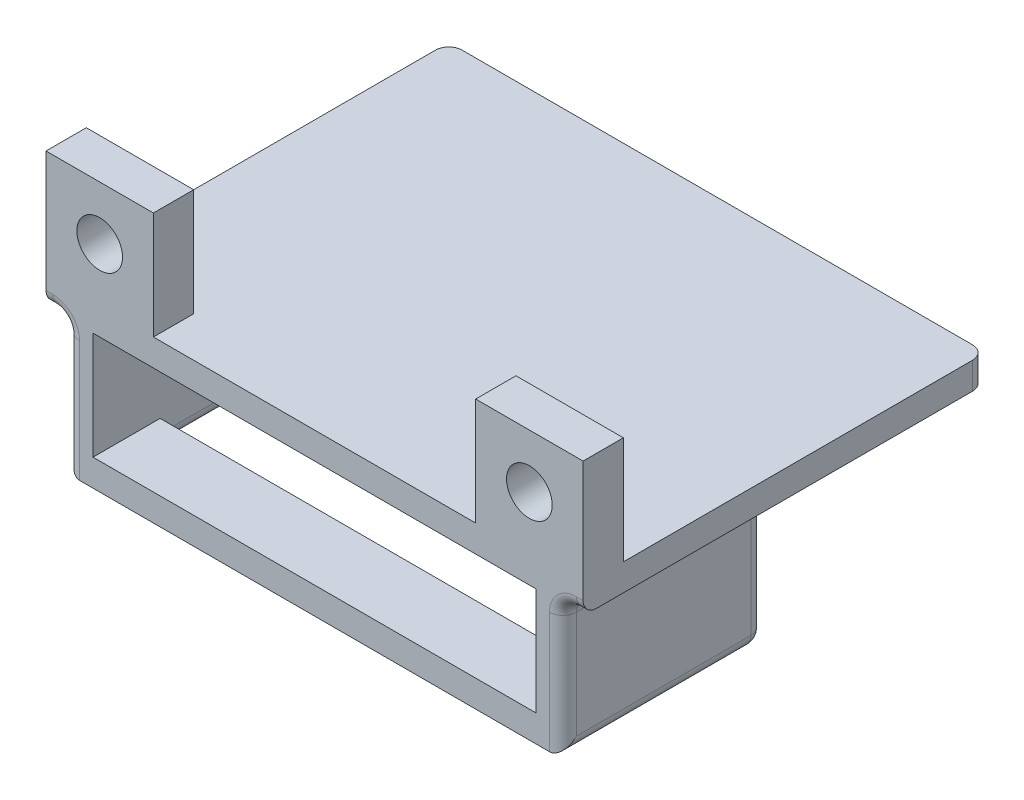
from build123d import *

# Parameters (mm, degrees)
SKETCH1_W            = 40
SKETCH1_H            = 30
BOSS_EXTRUDE1_DEPTH  = 1
SKETCH2_W            = 8
SKETCH2_H            = 3
BOSS_EXTRUDE2_DEPTH  = 8
M3_CLEARANCE_HOLE1_D = 3.4
BOSS_EXTRUDE3_DEPTH  = 5
SKETCH8_W            = 2
SKETCH8_H            = 10
BOSS_EXTRUDE4_DEPTH  = 10
FILLET1_R            = 1


with BuildPart() as part:
    # Sketch1 → Boss-Extrude1 (new, symmetric)
    with BuildSketch(Plane(origin=(0, 0, 0), x_dir=(1, 0, 0), z_dir=(0, 1, 0))):
        with Locations((20, 15)):
            Rectangle(SKETCH1_W, SKETCH1_H)
    extrude(amount=BOSS_EXTRUDE1_DEPTH, both=True)

    # Sketch2 → Boss-Extrude2 (add)
    with BuildSketch(Plane(origin=(0, 1, 0), x_dir=(1, 0, 0), z_dir=(0, 1, 0))):
        with Locations((4, 1.5)):
            Rectangle(SKETCH2_W, SKETCH2_H)
        with Locations((36, 1.5)):
            Rectangle(SKETCH2_W, SKETCH2_H)
    extrude(amount=BOSS_EXTRUDE2_DEPTH)

    # M3 Clearance Hole1 (through all)
    with Locations(Plane(origin=(0, 0, -3), x_dir=(-1, 0, 0), z_dir=(0, 0, -1))):
        with Locations((-4, 5), (-36, 5)):
            Hole(M3_CLEARANCE_HOLE1_D / 2)

    # Sketch7 → Boss-Extrude3 (add)
    with BuildSketch(Plane.XY):
        Polygon((1.5, -1), (1.5, -11), (38.5, -11), (38.5, -1), (36.5, -1), (36.5, -9), (3.5, -9), (3.5, -1), align=None)
    extrude(amount=-BOSS_EXTRUDE3_DEPTH)

    # Sketch8 → Boss-Extrude4 (add)
    with BuildSketch(Plane(origin=(0, 0, -5), x_dir=(-1, 0, 0), z_dir=(0, 0, -1))):
        with Locations((-37.5, -6)):
            Rectangle(SKETCH8_W, SKETCH8_H)
        with Locations((-2.5, -6)):
            Rectangle(SKETCH8_W, SKETCH8_H)
    extrude(amount=BOSS_EXTRUDE4_DEPTH)

    # Fillet1
    fillet1_edges = [part.edges().sort_by_distance(p)[0] for p in [
        (3.5, -11, -10),
        (2.5, -11, -15),
        (1.5, -6, -15),
        (2.5, -1, -15),
        (0.75, -1, 0),
        (39.25, -1, 0),
        (38.5, -1, -7.5),
        (38.5, -11, -7.5),
        (1.5, -11, -7.5),
        (1.5, -1, -7.5),
        (1.5, -6, 0),
        (38.5, -6, 0),
        (40, 0, -30),
        (0, 0, -30),
        (36.5, -11, -10),
        (38.5, -6, -15),
        (37.5, -11, -15),
        (37.5, -1, -15),
        (20, -11, -5),
    ]]
    fillet(fillet1_edges, radius=FILLET1_R - 0.0001)  # a hair under: the kernel refuses the full size


solid = part.part
